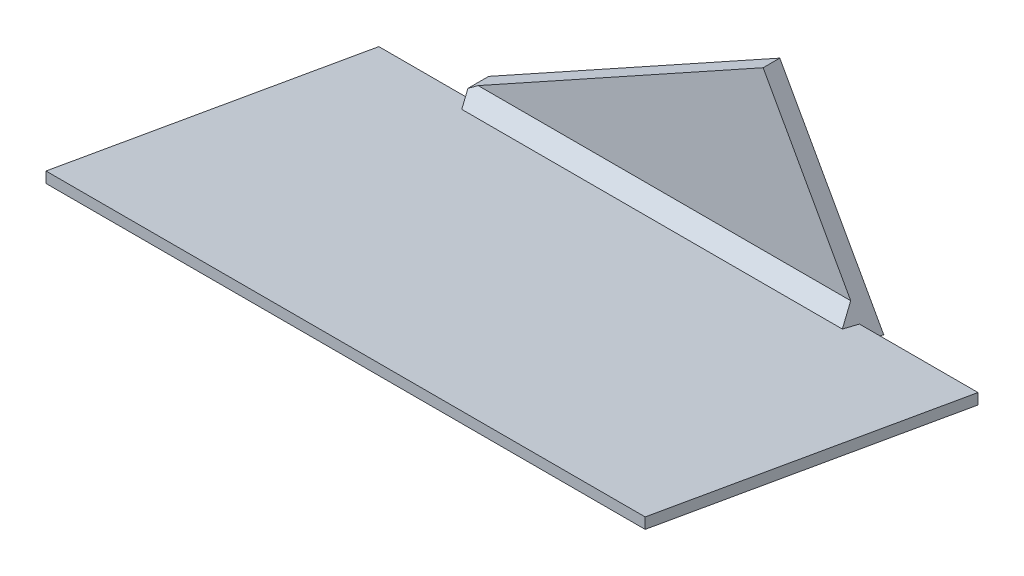
from build123d import *

# Parameters (mm, degrees)
SKETCH1_W           = 114.3
SKETCH1_H           = 63.5
BOSS_EXTRUDE1_DEPTH = 3.175
BOSS_EXTRUDE2_DEPTH = 3.175
BOSS_EXTRUDE3_START = -57.15
BOSS_EXTRUDE3_DEPTH = 114.3
CUT_EXTRUDE1_DEPTH  = 125.91911954
CHAMFER1_SIZE       = 2.54


# Read off the part's stored shape, not the designer's step: Boss-Extrude3
with BuildPart() as part:
    # Sketch1 → Boss-Extrude1 (new body)
    with BuildSketch(Plane(origin=(0, 0, 0), x_dir=(1, 0, 0), z_dir=(0, 1, 0))):
        Rectangle(SKETCH1_W, SKETCH1_H)
    extrude(amount=BOSS_EXTRUDE1_DEPTH)

    # Sketch2 → Boss-Extrude2 (add)
    with BuildSketch(Plane(origin=(0, 0, -31.75), x_dir=(-1, 0, 0), z_dir=(0, 0, -1))):
        Polygon((-16.15831866, 36.339246026), (39.380032744, 5.55383514), (36.301491655, 0), (-36.301491655, 0), align=None)
    extrude(amount=BOSS_EXTRUDE2_DEPTH)

    # Boss-Extrude3 outline → Boss-Extrude3 (add)
    with BuildSketch(Plane.YZ.offset(BOSS_EXTRUDE3_START)):
        Polygon((14.371763275, 31.75), (3.175, 31.75), (3.175, -31.75), align=None)
    extrude(amount=BOSS_EXTRUDE3_DEPTH)

    # Sketch4 → Cut-Extrude1 (cut, through all)
    with BuildSketch(Plane(origin=(57.15, 0, 0), x_dir=(0, 0, -1), z_dir=(1, 0, 0))):
        Polygon((-31.75, 12.3084164), (-31.75, 0), (34.925, 0), (34.925, 0.551814961), align=None)
    extrude(amount=-CUT_EXTRUDE1_DEPTH, mode=Mode.SUBTRACT)

    # Chamfer1
    # the kernel refuses this chamfer: 2.54 mm, written as the material it adds along each edge
    with BuildSketch(Plane(origin=(-45.794774456, 3.175, -31.75), x_dir=(0, 0.14881491150796153, 0.988865067697751), z_dir=(1, 0, 0))) as chamfer1_piece_1_section:
        Polygon((CHAMFER1_SIZE * 1.19137631147, -CHAMFER1_SIZE * 0.0299851619673), (CHAMFER1_SIZE * 0.177350705421, -CHAMFER1_SIZE * 1.17848349702), (0, 0), align=None)
    chamfer1_piece_1 = extrude(amount=88.069686436, mode=Mode.PRIVATE)
    chamfer1_piece_1 = split(chamfer1_piece_1, bisect_by=Plane(origin=(-30.181920022, -11.039999469, -30.75599928), z_dir=(0.8746197071393951, 0.48480962024633845, 0)), keep=Keep.TOP, mode=Mode.PRIVATE)
    chamfer1_piece_1 = split(chamfer1_piece_1, bisect_by=Plane(origin=(25.356431382, 19.745411417, -30.75599928), z_dir=(-0.8746197071393954, -0.4848096202463377, 0)), keep=Keep.TOP, mode=Mode.PRIVATE)
    chamfer1_piece_1 = split(chamfer1_piece_1, bisect_by=Plane(origin=(-11.60015099, 20.952475045, -30.75599928), z_dir=(0.4848096202463377, -0.8746197071393954, 0)), keep=Keep.TOP, mode=Mode.PRIVATE)
    add(chamfer1_piece_1)


solid = part.part
